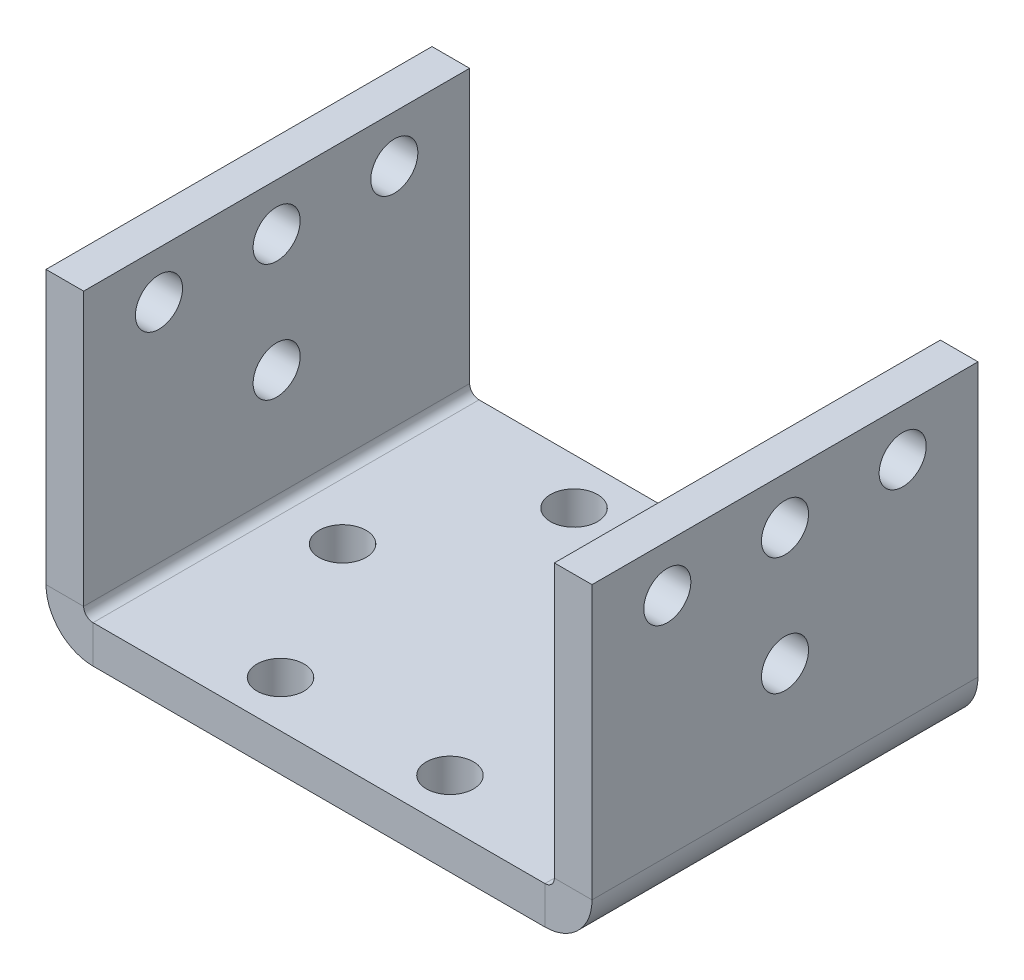
from build123d import *

# Parameters (mm, degrees)
SM_BASE_FLANGE_1_DEPTH   = 41
SKETCH_9_R               = 2.5
CUT_EXTRUDE_4_DEPTH      = 61.6465168
CUT_EXTRUDE_5_DEPTH      = 78.103826105
CUT_EXTRUDE_5_DEPTH_BACK = 78.103826105
SKETCH_10_R              = 2.5


# Sheet-metal steps are written as plain solids
with BuildPart() as part:
    # Sketch 1 → Базовая кромка1 (new body)
    with BuildSketch(Plane.XY):
        with BuildLine():
            Line((-25, 30), (-25, 1))
            ThreePointArc((-25, 1), (-24.707106781, 0.292893219), (-24, 0))
            Line((-24, 0), (24, 0))
            ThreePointArc((24, 0), (24.707106781, 0.292893219), (25, 1))
            Line((25, 1), (25, 30))
            Line((25, 30), (29, 30))
            Line((29, 30), (29, 1))
            ThreePointArc((29, 1), (27.535533906, -2.535533906), (24, -4))
            Line((24, -4), (-24, -4))
            ThreePointArc((-24, -4), (-27.535533906, -2.535533906), (-29, 1))
            Line((-29, 1), (-29, 30))
            Line((-29, 30), (-25, 30))
        make_face()
    extrude(amount=SM_BASE_FLANGE_1_DEPTH)

    # Эскиз9 → Вырез-Вытянуть4 (cut, through all)
    with BuildSketch(Plane.XZ.offset(4)):
        with Locations((-18, 20.5)):
            Circle(SKETCH_9_R)
        with Locations((-9, 36.088457268)):
            Circle(SKETCH_9_R)
        with Locations((9, 36.088457268)):
            Circle(SKETCH_9_R)
        with Locations((18, 20.5)):
            Circle(SKETCH_9_R)
        with Locations((9, 4.911542732)):
            Circle(SKETCH_9_R)
        with Locations((-9, 4.911542732)):
            Circle(SKETCH_9_R)
    extrude(amount=-CUT_EXTRUDE_4_DEPTH, mode=Mode.SUBTRACT)

    # Эскиз10 → Вырез-Вытянуть5 (cut, two sides: drawn at the far end of the back side and taken through both)
    with BuildSketch(Plane(origin=(29, 0, 0), x_dir=(0, 0, -1), z_dir=(1, 0, 0)).offset(-CUT_EXTRUDE_5_DEPTH_BACK)):
        with Locations((-33, 25)):
            Circle(SKETCH_10_R)
        with Locations((-20.5, 25)):
            Circle(SKETCH_10_R)
        with Locations((-8, 25)):
            Circle(SKETCH_10_R)
        with Locations((-20.5, 12.5)):
            Circle(SKETCH_10_R)
    extrude(amount=CUT_EXTRUDE_5_DEPTH + CUT_EXTRUDE_5_DEPTH_BACK, mode=Mode.SUBTRACT)


solid = part.part
